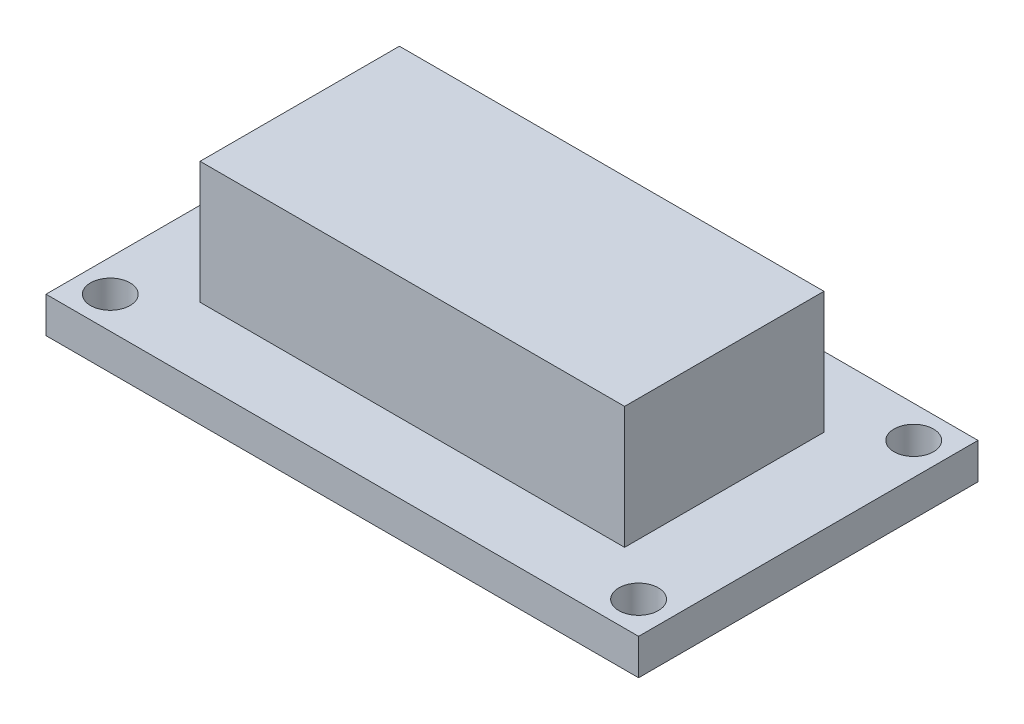
from build123d import *

# Parameters (mm, degrees)
SKETCH1_W           = 41.91
SKETCH1_H           = 24.003
SKETCH1_R           = 1.397
BOSS_EXTRUDE1_DEPTH = 2.54
SKETCH2_W           = 30.0228
SKETCH2_H           = 14.097
BOSS_EXTRUDE2_DEPTH = 8.636


with BuildPart() as part:
    # Sketch1 → Boss-Extrude1 (new body)
    with BuildSketch(Plane(origin=(0, 0, 0), x_dir=(1, 0, 0), z_dir=(0, 1, 0))):
        Rectangle(SKETCH1_W, SKETCH1_H)
        with Locations((-18.6817, 9.7282)):
            Circle(SKETCH1_R, mode=Mode.SUBTRACT)
        with Locations((-18.6817, -9.7282)):
            Circle(SKETCH1_R, mode=Mode.SUBTRACT)
        with Locations((18.6817, -9.7282)):
            Circle(SKETCH1_R, mode=Mode.SUBTRACT)
        with Locations((18.6817, 9.7282)):
            Circle(SKETCH1_R, mode=Mode.SUBTRACT)
    extrude(amount=BOSS_EXTRUDE1_DEPTH)

    # Sketch2 → Boss-Extrude2 (add)
    with BuildSketch(Plane(origin=(0, 2.54, 0), x_dir=(1, 0, 0), z_dir=(0, 1, 0))):
        Rectangle(SKETCH2_W, SKETCH2_H)
    extrude(amount=BOSS_EXTRUDE2_DEPTH)


solid = part.part
